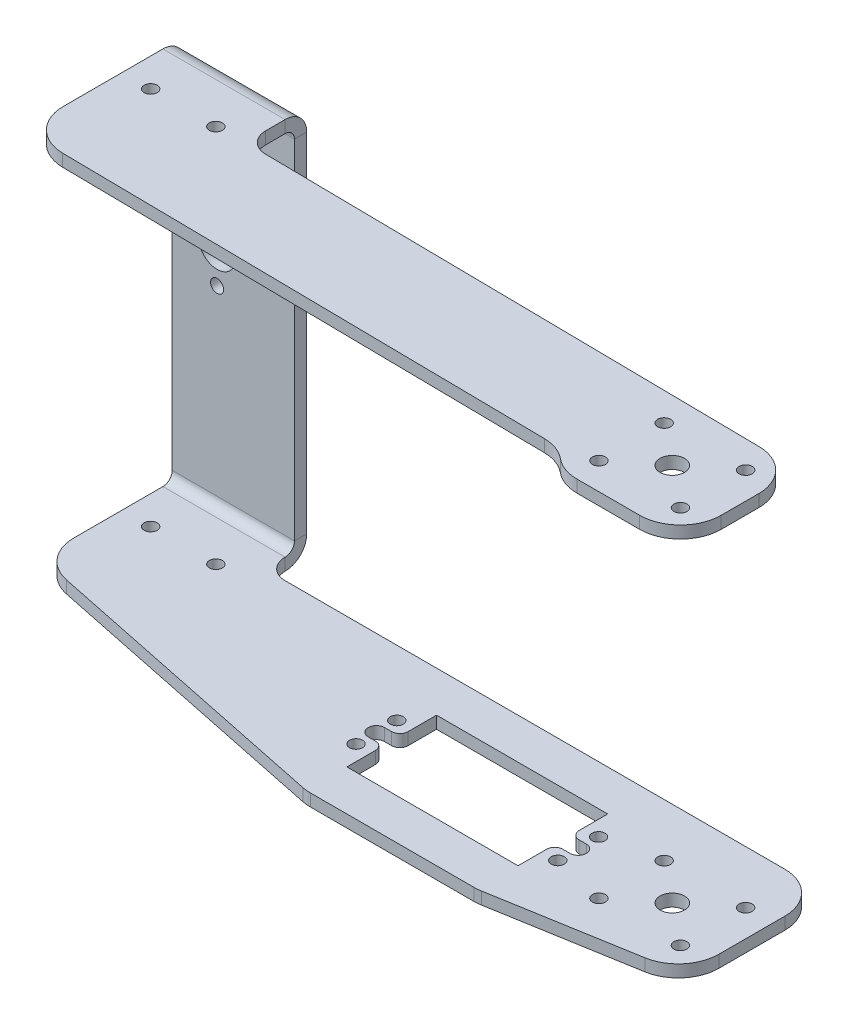
from build123d import *

# Parameters (mm, degrees)
ESBO_O11_W                   = 30
ESBO_O11_H                   = 85.4
FLANGE_BASE1_DEPTH           = 3
FURO_DE_DI_METRO_3_2_3_2_1_D = 3.2
FURO_DE_DI_METRO_9_0_9_1_D   = 9
ARESTA_FLANGE1_DEPTH         = 30
ARESTA_FLANGE1_START         = 3
ARESTA_FLANGE1_PROFILE_R     = 1.6
ARESTA_FLANGE1_PROFILE_R_2   = 3
ARESTA_FLANGE1_FLAT_DEPTH    = 3
ARESTA_FLANGE2_DEPTH         = 30
ARESTA_FLANGE2_START         = 3
ARESTA_FLANGE2_PROFILE_R     = 1.6
ARESTA_FLANGE2_PROFILE_R_2   = 3
ARESTA_FLANGE2_FLAT_DEPTH    = 3
ESBO_O28_R                   = 1.6
CORTE_EXTRUS_O1_DEPTH        = 191.983899845


# Sheet-metal steps are written as plain solids
with BuildPart() as part:
    # Esboço11 → Flange-base1 (new body)
    with BuildSketch(Plane(origin=(0, 0, 0), x_dir=(-1, 0, 0), z_dir=(0, 0, -1))):
        with Locations((-4, 0)):
            Rectangle(ESBO_O11_W, ESBO_O11_H)
    extrude(amount=-FLANGE_BASE1_DEPTH)

    # Furo de diâmetro Ø3.2 (3.2)1 (through all)
    with Locations(Plane.XY.offset(3)):
        with Locations((0, 18), (0, 2)):
            Hole(FURO_DE_DI_METRO_3_2_3_2_1_D / 2)

    # Furo de diâmetro Ø9.0 (9)1 (through all)
    with Locations(Plane.XY.offset(3)):
        with Locations((0, 10)):
            Hole(FURO_DE_DI_METRO_9_0_9_1_D / 2)

    # Aresta-Flange1 bend section (across the edge) → Aresta-Flange1 (add)
    with BuildSketch(Plane(origin=(-11, -45, 3), x_dir=(0, 1, 0), z_dir=(1, 0, 0))):
        with BuildLine():
            Line((-3, 2.3), (0, 2.3))
            ThreePointArc((0, 2.3), (0.673654403, 0.673654403), (2.3, 0))
            Line((2.3, 0), (2.3, -3))
            ThreePointArc((2.3, -3), (-1.44766594, -1.44766594), (-3, 2.3))
        make_face()
    extrude(amount=ARESTA_FLANGE1_DEPTH)

    # Aresta-Flange1 profile (on flange) → Aresta-Flange1 flat (add)
    with BuildSketch(Plane(origin=(0, -45, 3), x_dir=(1, 0, 0), z_dir=(0, -1, 0)).offset(ARESTA_FLANGE1_START)):
        with BuildLine():
            Line((148.286348541, 43.289074758), (113.989303003, 49.156785916))
            ThreePointArc((113.989303003, 49.156785916), (113.149163903, 49.264132154), (112.302954462, 49.3))
            Line((112.302954462, 49.3), (72.176029381, 49.3))
            ThreePointArc((72.176029381, 49.3), (71.15753405, 49.247998153), (70.149631446, 49.092533452))
            Line((70.149631446, 49.092533452), (-3.026397935, 33.950001079))
            ThreePointArc((-3.026397935, 33.950001079), (-8.754481909, 30.471579625), (-11, 24.157467627))
            Line((-11, 24.157467627), (-11, 2.3))
            Line((-11, 2.3), (19, 2.3))
            ThreePointArc((19, 2.3), (20.464466094, 5.835533906), (24, 7.3))
            Line((24, 7.3), (146.6, 7.3))
            ThreePointArc((146.6, 7.3), (153.671067812, 10.228932188), (156.6, 17.3))
            Line((156.6, 17.3), (156.6, 33.432288841))
            ThreePointArc((156.6, 33.432288841), (154.244065849, 39.879633822), (148.286348541, 43.289074758))
        make_face()
        with Locations((150, 20.3)):
            Circle(ARESTA_FLANGE1_PROFILE_R, mode=Mode.SUBTRACT)
        with Locations((130, 20.3)):
            Circle(ARESTA_FLANGE1_PROFILE_R, mode=Mode.SUBTRACT)
        with Locations((116.90221, 23.3)):
            Circle(ARESTA_FLANGE1_PROFILE_R, mode=Mode.SUBTRACT)
        with Locations((67.40221, 23.3)):
            Circle(ARESTA_FLANGE1_PROFILE_R, mode=Mode.SUBTRACT)
        with Locations((140, 28.3)):
            Circle(ARESTA_FLANGE1_PROFILE_R_2, mode=Mode.SUBTRACT)
        with Locations((116.90221, 33.3)):
            Circle(ARESTA_FLANGE1_PROFILE_R, mode=Mode.SUBTRACT)
        with Locations((150, 36.3)):
            Circle(ARESTA_FLANGE1_PROFILE_R, mode=Mode.SUBTRACT)
        with Locations((130, 36.3)):
            Circle(ARESTA_FLANGE1_PROFILE_R, mode=Mode.SUBTRACT)
        with BuildLine():
            Line((115.15221, 30.3), (116.90221, 30.3))
            ThreePointArc((116.90221, 30.3), (118.90221, 28.3), (116.90221, 26.3))
            Line((116.90221, 26.3), (115.15221, 26.3))
            ThreePointArc((115.15221, 26.3), (113.737996438, 25.714213562), (113.15221, 24.3))
            Line((113.15221, 24.3), (113.15221, 17.3))
            Line((113.15221, 17.3), (71.15221, 17.3))
            Line((71.15221, 17.3), (71.15221, 24.3))
            ThreePointArc((71.15221, 24.3), (70.566423562, 25.714213562), (69.15221, 26.3))
            Line((69.15221, 26.3), (67.40221, 26.3))
            ThreePointArc((67.40221, 26.3), (65.40221, 28.3), (67.40221, 30.3))
            Line((67.40221, 30.3), (69.15221, 30.3))
            ThreePointArc((69.15221, 30.3), (70.566423562, 30.885786438), (71.15221, 32.3))
            Line((71.15221, 32.3), (71.15221, 39.3))
            Line((71.15221, 39.3), (113.15221, 39.3))
            Line((113.15221, 39.3), (113.15221, 32.3))
            ThreePointArc((113.15221, 32.3), (113.737996438, 30.885786438), (115.15221, 30.3))
        make_face(mode=Mode.SUBTRACT)
        with Locations((67.40221, 33.3)):
            Circle(ARESTA_FLANGE1_PROFILE_R, mode=Mode.SUBTRACT)
    extrude(amount=-ARESTA_FLANGE1_FLAT_DEPTH)

    # Aresta-Flange2 bend section (across the edge) → Aresta-Flange2 (add)
    with BuildSketch(Plane(origin=(19, 45, 3), x_dir=(0, -1, 0), z_dir=(-1, 0, 0))):
        with BuildLine():
            Line((-3, 2.3), (0, 2.3))
            ThreePointArc((0, 2.3), (0.673654403, 0.673654403), (2.3, 0))
            Line((2.3, 0), (2.3, -3))
            ThreePointArc((2.3, -3), (-1.44766594, -1.44766594), (-3, 2.3))
        make_face()
    extrude(amount=ARESTA_FLANGE2_DEPTH)

    # Aresta-Flange2 profile (on flange) → Aresta-Flange2 flat (add)
    with BuildSketch(Plane(origin=(0, 45, 3), x_dir=(-1, 0, 0), z_dir=(0, 1, 0)).offset(ARESTA_FLANGE2_START)):
        with BuildLine():
            ThreePointArc((-118.587276174, 38.294035384), (-121.912170898, 38.908863825), (-124.842101896, 40.596597007))
            ThreePointArc((-124.842101896, 40.596597007), (-127.832972518, 42.306539483), (-131.226645302, 42.9))
            Line((-131.226645302, 42.9), (-146.6, 42.9))
            ThreePointArc((-146.6, 42.9), (-153.671067812, 39.971067812), (-156.6, 32.9))
            Line((-156.6, 32.9), (-156.6, 23.656178366))
            ThreePointArc((-156.6, 23.656178366), (-153.716782168, 16.631122382), (-146.729717684, 13.657019735))
            Line((-146.729717684, 13.657019735), (-23.935141158, 12.064022895))
            ThreePointArc((-23.935141158, 12.064022895), (-20.441608916, 10.576971572), (-19, 7.06444358))
            Line((-19, 7.06444358), (-19, 2.3))
            Line((-19, 2.3), (11, 2.3))
            Line((11, 2.3), (11, 26.741804962))
            ThreePointArc((11, 26.741804962), (8.116782168, 33.766860946), (1.129717684, 36.740963592))
            Line((1.129717684, 36.740963592), (-118.587276174, 38.294035384))
        make_face()
        with Locations((-130, 20.3)):
            Circle(ARESTA_FLANGE2_PROFILE_R, mode=Mode.SUBTRACT)
        with Locations((-150, 20.3)):
            Circle(ARESTA_FLANGE2_PROFILE_R, mode=Mode.SUBTRACT)
        with Locations((-130, 36.3)):
            Circle(ARESTA_FLANGE2_PROFILE_R, mode=Mode.SUBTRACT)
        with Locations((-140, 28.3)):
            Circle(ARESTA_FLANGE2_PROFILE_R_2, mode=Mode.SUBTRACT)
        with Locations((-150, 36.3)):
            Circle(ARESTA_FLANGE2_PROFILE_R, mode=Mode.SUBTRACT)
    extrude(amount=-ARESTA_FLANGE2_FLAT_DEPTH)

    # Esboço28 → Corte-extrusão1 (cut, through all)
    with BuildSketch(Plane.XZ.offset(48)):
        with Locations(Location((-4, 15.3, 0), (0, 0, 270))):
            Circle(ESBO_O28_R)
        with Locations(Location((12, 15.3, 0), (0, 0, 270))):
            Circle(ESBO_O28_R)
    extrude(amount=-CORTE_EXTRUS_O1_DEPTH, mode=Mode.SUBTRACT)


solid = part.part
